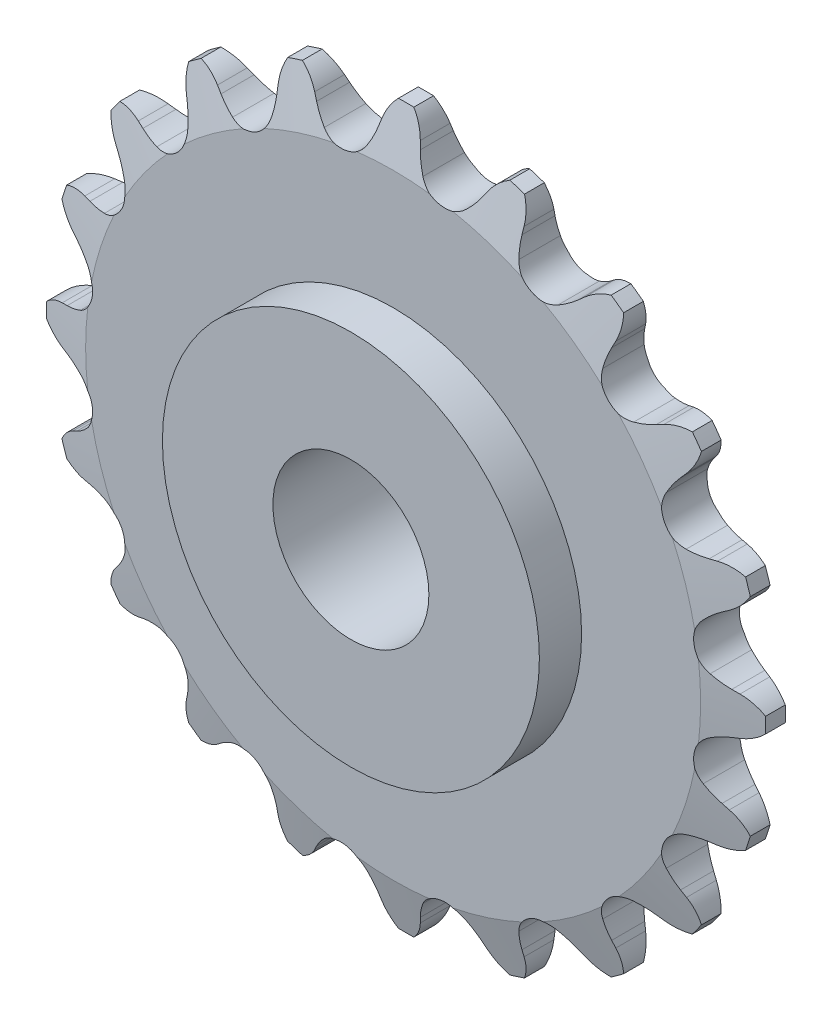
from build123d import *

# Parameters (mm, degrees)
CUT_EXTRUDE1_DEPTH      = 32.075047107
CIRPATTERN1_COUNT       = 20
SKETCH2_R               = 11.509375
BOSS_EXTRUDE1_DEPTH     = 3.9751
CUT_EXTRUDE2_DEPTH      = 32.297098467
CUT_EXTRUDE2_DEPTH_BACK = 32.297098467
SKETCH3_R               = 4.7625


with BuildPart() as part:
    # Sketch1 → Revolve1 (revolve)
    with BuildSketch(Plane(origin=(0, 0, 0), x_dir=(0, 0, -1), z_dir=(1, 0, 0))):
        Polygon((-1.397, 0), (1.397, 0), (1.397, 18.776161059), (0.60325, 21.951161059), (-0.60325, 21.951161059), (-1.397, 18.776161059), align=None)
    revolve(axis=Axis((0, 0, 1.397), (0, 0, -1)))

    # Sketch0 → Cut-Extrude1 (cut, symmetric)
    with BuildSketch(Plane.XY):
        with BuildLine():
            Line((5.277180446, -20.040203011), (5.061079282, -19.691667514))
            ThreePointArc((5.061079282, -19.691667514), (4.726289334, -19.224037863), (4.332593326, -18.804794197))
            ThreePointArc((4.332593326, -18.804794197), (2.909475179, -18.369703316), (1.690459867, -19.223267026))
            ThreePointArc((1.690459867, -19.223267026), (1.445586131, -19.743650204), (1.271687479, -20.291848214))
            Line((1.271687479, -20.291848214), (1.17386645, -20.690104102))
            ThreePointArc((1.17386645, -20.690104102), (0.140296792, -22.229219968), (-1.642266934, -22.738739792))
            ThreePointArc((-1.642266934, -22.738739792), (3.56638787, -22.517286816), (8.588545696, -21.118338259))
            ThreePointArc((8.588545696, -21.118338259), (6.735776564, -21.184598596), (5.277180446, -20.040203011))
        make_face()
    cut_extrude1 = extrude(amount=CUT_EXTRUDE1_DEPTH, both=True, mode=Mode.SUBTRACT)

    # CirPattern1: Cut-Extrude1 ×20 about axis
    cirpattern1_axis = Axis((0, 0, 1.397), (0, 0, 1))
    for i in range(1, CIRPATTERN1_COUNT):
        add(cut_extrude1.rotate(cirpattern1_axis, i * 360 / CIRPATTERN1_COUNT), mode=Mode.SUBTRACT)

    # Sketch2 → Boss-Extrude1 (add, symmetric)
    with BuildSketch(Plane.XY):
        Circle(SKETCH2_R)
    extrude(amount=BOSS_EXTRUDE1_DEPTH, both=True)

    # Sketch3 → Cut-Extrude2 (cut, two sides: drawn at the far end of the back side and taken through both)
    with BuildSketch(Plane.XY.offset(-CUT_EXTRUDE2_DEPTH_BACK)):
        Circle(SKETCH3_R)
    extrude(amount=CUT_EXTRUDE2_DEPTH + CUT_EXTRUDE2_DEPTH_BACK, mode=Mode.SUBTRACT)


solid = part.part
